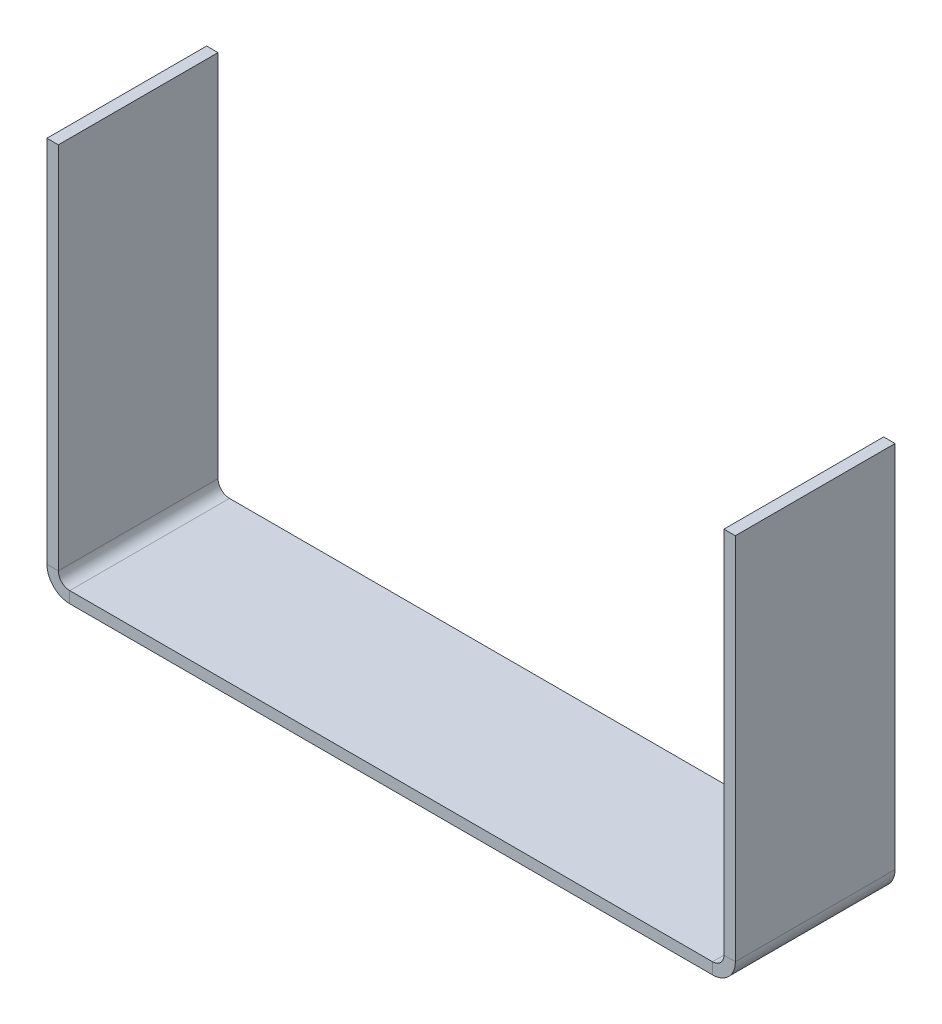
from build123d import *

# Parameters (mm, degrees)
BASE_FLANGE1_DEPTH = 21


# Sheet-metal steps are written as plain solids
with BuildPart() as part:
    # Sketch1 → Base-Flange1 (new, symmetric)
    with BuildSketch(Plane.XY):
        with BuildLine():
            Line((-87.5, 100), (-87.5, 3))
            ThreePointArc((-87.5, 3), (-86.621320344, 0.878679656), (-84.5, 0))
            Line((-84.5, 0), (84.5, 0))
            ThreePointArc((84.5, 0), (86.621320344, 0.878679656), (87.5, 3))
            Line((87.5, 3), (87.5, 100))
            Line((87.5, 100), (90.5, 100))
            Line((90.5, 100), (90.5, 3))
            ThreePointArc((90.5, 3), (88.742640687, -1.242640687), (84.5, -3))
            Line((84.5, -3), (-84.5, -3))
            ThreePointArc((-84.5, -3), (-88.742640687, -1.242640687), (-90.5, 3))
            Line((-90.5, 3), (-90.5, 100))
            Line((-90.5, 100), (-87.5, 100))
        make_face()
    extrude(amount=BASE_FLANGE1_DEPTH, both=True)


solid = part.part
